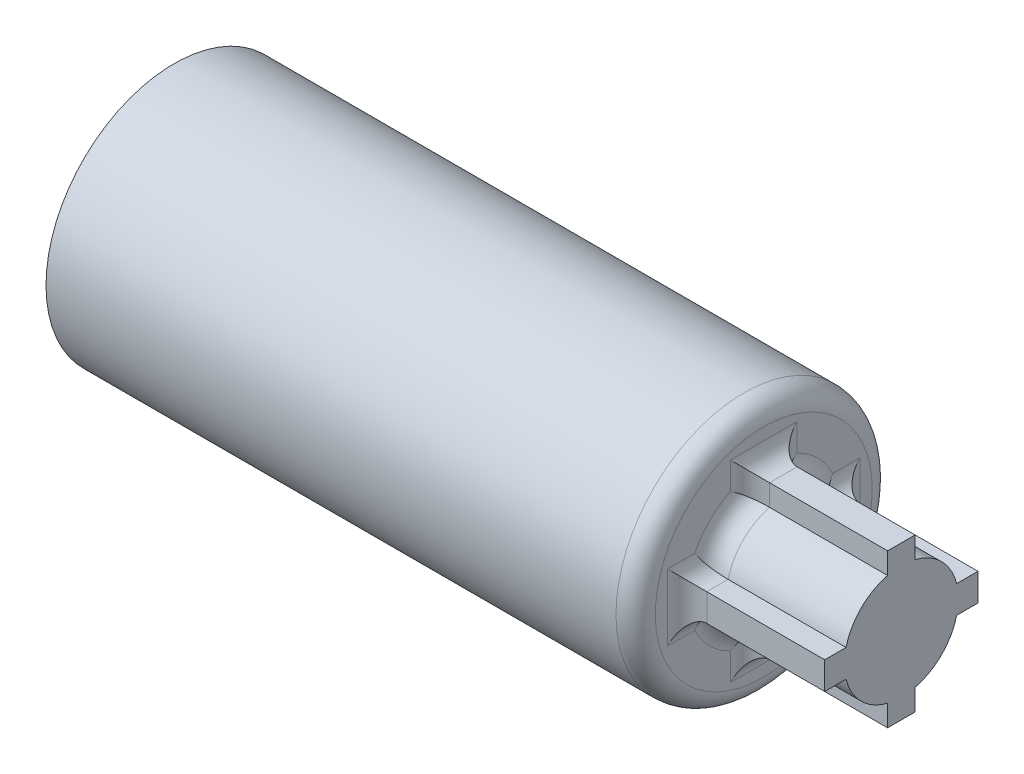
from build123d import *

# Parameters (mm, degrees)
BOSS_EXTRUDE1_DEPTH = 3.5
SKETCH1_3_R         = 3.259306638
BOSS_EXTRUDE2_DEPTH = 1
SKETCH1_4_R         = 3.259306638
BOSS_EXTRUDE3_DEPTH = 15
FILLET1_R           = 0.5


with BuildPart() as part:
    # Sketch1 → Boss-Extrude1 (new body)
    with BuildSketch(Plane.ZY.offset(-9.072873839)):
        with BuildLine():
            Line((-21.714889637, -15.686916163), (-21.714889637, -15.144040891))
            Line((-21.714889637, -15.144040891), (-22.414889637, -15.144040891))
            Line((-22.414889637, -15.144040891), (-22.414889637, -15.686916163))
            ThreePointArc((-22.414889637, -15.686916163), (-23.09019447, -16.068736058), (-23.472014365, -16.744040891))
            Line((-23.472014365, -16.744040891), (-24.014889637, -16.744040891))
            Line((-24.014889637, -16.744040891), (-24.014889637, -17.444040891))
            Line((-24.014889637, -17.444040891), (-23.472014365, -17.444040891))
            ThreePointArc((-23.472014365, -17.444040891), (-23.09019447, -18.119345724), (-22.414889637, -18.501165619))
            Line((-22.414889637, -18.501165619), (-22.414889637, -19.044040891))
            Line((-22.414889637, -19.044040891), (-21.714889637, -19.044040891))
            Line((-21.714889637, -19.044040891), (-21.714889637, -18.501165619))
            ThreePointArc((-21.714889637, -18.501165619), (-21.039584805, -18.119345724), (-20.657764909, -17.444040891))
            Line((-20.657764909, -17.444040891), (-20.114889637, -17.444040891))
            Line((-20.114889637, -17.444040891), (-20.114889637, -16.744040891))
            Line((-20.114889637, -16.744040891), (-20.657764909, -16.744040891))
            ThreePointArc((-20.657764909, -16.744040891), (-21.039584805, -16.068736058), (-21.714889637, -15.686916163))
        make_face()
    extrude(amount=-BOSS_EXTRUDE1_DEPTH)

    # Sketch1<3> → Boss-Extrude2 (add)
    with BuildSketch(Plane.ZY.offset(-9.072873839)):
        with Locations((-22.064889637, -17.094040891)):
            Circle(SKETCH1_3_R)
    extrude(amount=BOSS_EXTRUDE2_DEPTH)

    # Sketch1<4> → Boss-Extrude3 (add)
    with BuildSketch(Plane.ZY.offset(-9.072873839)):
        with Locations((-22.064889637, -17.094040891)):
            Circle(SKETCH1_4_R)
        with BuildLine():
            ThreePointArc((-23.752066801, -19.072280821), (-21.868548232, -14.501464942), (-20.694879361, -19.303808263))
            Line((-20.694879361, -19.303808263), (-23.752066801, -19.072280821))
        make_face(mode=Mode.SUBTRACT)
    extrude(amount=BOSS_EXTRUDE3_DEPTH)

    # Fillet1
    fillet1_edges = [part.edges().sort_by_distance(p)[0] for p in [
        (9.072873839, -17.094040891, -25.324196275),
        (9.072873839, -16.744040891, -23.743452001),
        (9.072873839, -16.068736058, -23.09019447),
        (9.072873839, -15.415478527, -22.414889637),
        (9.072873839, -15.144040891, -22.064889637),
        (9.072873839, -15.415478527, -21.714889637),
        (9.072873839, -16.068736058, -21.039584805),
        (9.072873839, -16.744040891, -20.386327273),
        (9.072873839, -17.094040891, -20.114889637),
        (9.072873839, -17.444040891, -20.386327273),
        (9.072873839, -18.119345724, -21.039584805),
        (9.072873839, -18.772603255, -21.714889637),
        (9.072873839, -19.044040891, -22.064889637),
        (9.072873839, -18.772603255, -22.414889637),
        (9.072873839, -18.119345724, -23.09019447),
        (9.072873839, -17.444040891, -23.743452001),
        (9.072873839, -17.094040891, -24.014889637),
    ]]
    fillet(fillet1_edges, radius=FILLET1_R)


solid = part.part
